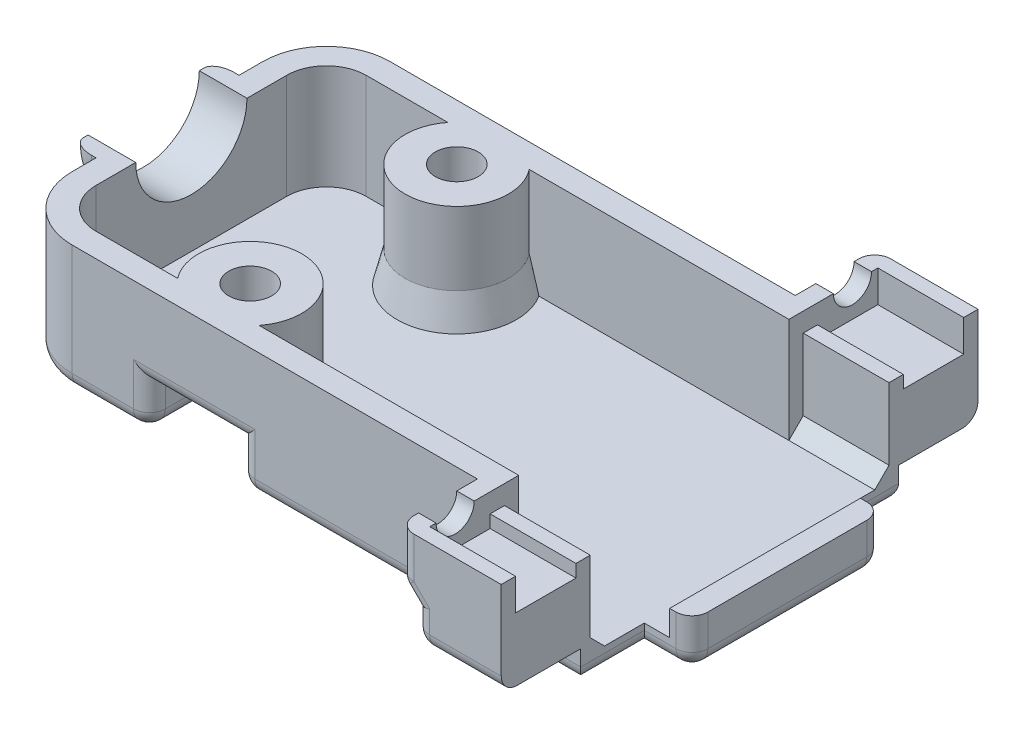
from build123d import *

# Parameters (mm, degrees)
BASE_DEPTH           = 8
LOGOPLACE_DEPTH      = 0.5
CONNECTORPLACE_DEPTH = 12.5
BOSS_EXTRUDE2_DEPTH  = 5
CUT_EXTRUDE4_DEPTH   = 6.6
CHAMFER1_SIZE        = 0.5
CHAMFER1_SIZE2       = 2.005390467
NUTHOLDER_DEPTH      = 2.7
CUT_EXTRUDE5_DEPTH   = 5.4
SKETCH8_R            = 1.2
FORSCREW_DEPTH       = 5.4
CABLEHOLE_DEPTH      = 5.4
BOSS_EXTRUDE3_START  = 1.5
BOSS_EXTRUDE3_DEPTH  = 1.5
CABLEFILLET_SIZE     = 0.7
CABLEFILLET_SIZE_2   = 1.2
SKETCH10_R           = 1.35
MOUNTHOLES_DEPTH     = 11.7
FILLETALL_R          = 1


with BuildPart() as part:
    # Sketch1 → Base (new body)
    with BuildSketch(Plane(origin=(0, 0, 0), x_dir=(1, 0, 0), z_dir=(0, 1, 0))):
        with BuildLine():
            Line((16.5, 6), (16.5, 10))
            Line((16.5, 10), (-15.5, 10))
            ThreePointArc((-15.5, 10), (-18.328427125, 8.828427125), (-19.5, 6))
            Line((-19.5, 6), (-19.5, -6))
            ThreePointArc((-19.5, -6), (-18.328427125, -8.828427125), (-15.5, -10))
            Line((-15.5, -10), (16.5, -10))
            Line((16.5, -10), (16.5, -6))
            Line((16.5, -6), (19.5, -6))
            Line((19.5, -6), (19.5, 6))
            Line((19.5, 6), (16.5, 6))
        make_face()
    extrude(amount=BASE_DEPTH)

    # Sketch4 → LogoPlace (cut)
    with BuildSketch(Plane.XZ):
        with BuildLine():
            Line((1.5, 6), (7.5, 6))
            ThreePointArc((7.5, 6), (8.207106781, 5.707106781), (8.5, 5))
            Line((8.5, 5), (8.5, -5))
            ThreePointArc((8.5, -5), (8.207106781, -5.707106781), (7.5, -6))
            Line((7.5, -6), (1.5, -6))
            ThreePointArc((1.5, -6), (0.792893219, -5.707106781), (0.5, -5))
            Line((0.5, -5), (0.5, 5))
            ThreePointArc((0.5, 5), (0.792893219, 5.707106781), (1.5, 6))
        make_face()
    extrude(amount=-LOGOPLACE_DEPTH, mode=Mode.SUBTRACT)

    # Sketch5 → ConnectorPlace (cut, symmetric)
    with BuildSketch(Plane.XY):
        Polygon((16.5, 8.506394904), (16.5, 1.4), (18.1, 1.4), (18.1, 3), (19.890588566, 3), (19.890588566, 8.506394904), align=None)
    extrude(amount=CONNECTORPLACE_DEPTH, both=True, mode=Mode.SUBTRACT)

    # Sketch2 → Boss-Extrude2 (add)
    with BuildSketch(Plane.XY.offset(10)):
        Polygon((16.5, 8), (16.5, 2), (11, 2), (11, 4), (10, 5), (10, 8), align=None)
    boss_extrude2 = extrude(amount=BOSS_EXTRUDE2_DEPTH)

    # Sketch6 → Cut-Extrude4 (cut)
    with BuildSketch(Plane(origin=(0, 8, 0), x_dir=(1, 0, 0), z_dir=(0, 1, 0))):
        with BuildLine():
            Line((-5.238262309, -8.5), (11.5, -8.5))
            Line((11.5, -8.5), (16.5, -8.5))
            Line((16.5, -8.5), (16.5, 8.5))
            Line((16.5, 8.5), (-5.238262309, 8.5))
            ThreePointArc((-5.238262309, 8.5), (-7.8, 3.25), (-10.361737691, 8.5))
            Line((-10.361737691, 8.5), (-15.5, 8.5))
            ThreePointArc((-15.5, 8.5), (-17.267766953, 7.767766953), (-18, 6))
            Line((-18, 6), (-18, -6))
            ThreePointArc((-18, -6), (-17.267766953, -7.767766953), (-15.5, -8.5))
            Line((-15.5, -8.5), (-10.361737691, -8.5))
            ThreePointArc((-10.361737691, -8.5), (-7.8, -3.25), (-5.238262309, -8.5))
        make_face()
    extrude(amount=-CUT_EXTRUDE4_DEPTH, mode=Mode.SUBTRACT)

    # Chamfer1
    chamfer1_edges = [part.edges().sort_by_distance(p)[0] for p in [
        (-7.8, 1.4, -3.25),
        (-7.8, 1.4, 3.25),
    ]]
    chamfer1_side = [part.faces().sort_by_distance(p)[0] for p in [
        (0.709426011, 1.4, 0),
    ]]
    chamfer(chamfer1_edges, length=CHAMFER1_SIZE, length2=CHAMFER1_SIZE2, reference=chamfer1_side[0])

    # Sketch3 → NutHolder (cut)
    with BuildSketch(Plane.XZ):
        Polygon((-10.638765881, 10), (-4.988765881, 10), (-4.988765881, 4.9), (-7.813765881, 3.26898549), (-10.638765881, 4.9), align=None)
    nutholder = extrude(amount=-NUTHOLDER_DEPTH, mode=Mode.SUBTRACT)

    # Sketch7 → Cut-Extrude5 (cut)
    with BuildSketch(Plane(origin=(16.5, 0, 0), x_dir=(0, 0, -1), z_dir=(1, 0, 0))):
        Polygon((-14.1, 8.555566344), (-14.1, 8), (-14.1, 6), (-10.3, 6), (-10.3, 6.8), (-9.4, 6.8), (-9.4, 2.3), (-8.5, 1.4), (-8.5, 8.555566344), align=None)
    cut_extrude5 = extrude(amount=-CUT_EXTRUDE5_DEPTH, mode=Mode.SUBTRACT)

    # Sketch8 → ForScrew (cut)
    with BuildSketch(Plane.ZY.offset(-10)):
        with Locations((12.5, 8)):
            Circle(SKETCH8_R)
    forscrew = extrude(amount=-FORSCREW_DEPTH, mode=Mode.SUBTRACT)

    # Sketch9 → CableHole (cut)
    with BuildSketch(Plane.ZY.offset(19.5)):
        with BuildLine():
            Line((3.5, 8), (-3.5, 8))
            ThreePointArc((-3.5, 8), (0, 4.5), (3.5, 8))
        make_face()
    extrude(amount=-CABLEHOLE_DEPTH, mode=Mode.SUBTRACT)

    # Sketch9<4> → Boss-Extrude3 (add)
    with BuildSketch(Plane.ZY.offset(19.5).offset(BOSS_EXTRUDE3_START)):
        with BuildLine():
            Line((-3.5, 8), (-4.5, 8))
            ThreePointArc((-4.5, 8), (0, 3.5), (4.5, 8))
            Line((4.5, 8), (3.5, 8))
            ThreePointArc((3.5, 8), (0, 4.5), (-3.5, 8))
        make_face()
    extrude(amount=-BOSS_EXTRUDE3_DEPTH)

    # Mirror1: Boss-Extrude2, NutHolder, Cut-Extrude5, ForScrew across plane
    add(boss_extrude2.mirror(Plane.XY))
    add(nutholder.mirror(Plane.XY), mode=Mode.SUBTRACT)
    add(cut_extrude5.mirror(Plane.XY), mode=Mode.SUBTRACT)
    add(forscrew.mirror(Plane.XY), mode=Mode.SUBTRACT)

    # CableFillet
    # an asymmetric fillet: 1.2, 0.7 mm, written as the material it takes off along each edge
    with BuildSketch(Plane(origin=(-21, 8, 0), x_dir=(0, 0.6192120177237909, -0.7852238388551585), z_dir=(0, 0.7852238388551585, 0.6192120177237909))) as cablefillet_piece_1:
        with BuildLine():
            Bezier((4.5 - CABLEFILLET_SIZE, 0), (4.5, 0), (4.5, -CABLEFILLET_SIZE_2), weights=[1, 0.707106781, 1])
            Line((4.5, -CABLEFILLET_SIZE_2), (4.5, 0))
            Line((4.5, 0), (4.5 - CABLEFILLET_SIZE, 0))
        make_face()
    revolve(axis=Axis((-21, 8, 0), (-1, 0, 0)), revolution_arc=256.51722928, mode=Mode.SUBTRACT)

    # Sketch10 → MountHoles (cut)
    with BuildSketch(Plane(origin=(0, 8, 0), x_dir=(1, 0, 0), z_dir=(0, 1, 0))):
        with Locations(Location((-7.8, 6.5, 0), (0, 0, 270))):
            Circle(SKETCH10_R)
        with Locations(Location((-7.8, -6.5, 0), (0, 0, 270))):
            Circle(SKETCH10_R)
    extrude(amount=-MOUNTHOLES_DEPTH, mode=Mode.SUBTRACT)

    # FilletAll
    filletall_edges = [part.edges().sort_by_distance(p)[0] for p in [
        (16.5, 0, 8),
        (18, 0, 6),
        (19.5, 1.5, 6),
        (18, 0, -6),
        (19.5, 1.5, -6),
        (16.5, 0, -8),
        (-4.988765881, 0, 7.45),
        (-4.988765881, 1.35, 10),
        (-7.813765881, 2.7, 10),
        (-10.638765881, 0, 7.45),
        (-10.638765881, 1.35, 10),
        (13.75, 2, 15),
        (11, 3, 15),
        (10.5, 4.5, 15),
        (10, 6.5, 15),
        (11, 2, 12.5),
        (-13.06938294, 0, 10),
        (5.75561706, 0, 10),
        (-6.401265881, 0, 4.084492745),
        (-9.226265881, 0, 4.084492745),
        (-18.328427125, 0, 8.828427125),
        (-19.5, 0, 0),
        (-18.328427125, 0, -8.828427125),
        (-13.06938294, 0, -10),
        (-10.638765881, 0, -7.45),
        (-9.226265881, 0, -4.084492745),
        (-6.401265881, 0, -4.084492745),
        (-4.988765881, 0, -7.45),
        (5.75561706, 0, -10),
        (19.5, 0, 0),
        (-4.988765881, 1.35, -10),
        (-7.813765881, 2.7, -10),
        (-10.638765881, 1.35, -10),
        (11, 2, -12.5),
        (13.75, 2, -15),
        (11, 3, -15),
        (10.5, 4.5, -15),
        (10, 6.5, -15),
        (10, 5, 12.5),
        (10, 5, -12.5),
    ]]
    fillet(filletall_edges, radius=FILLETALL_R)


solid = part.part
